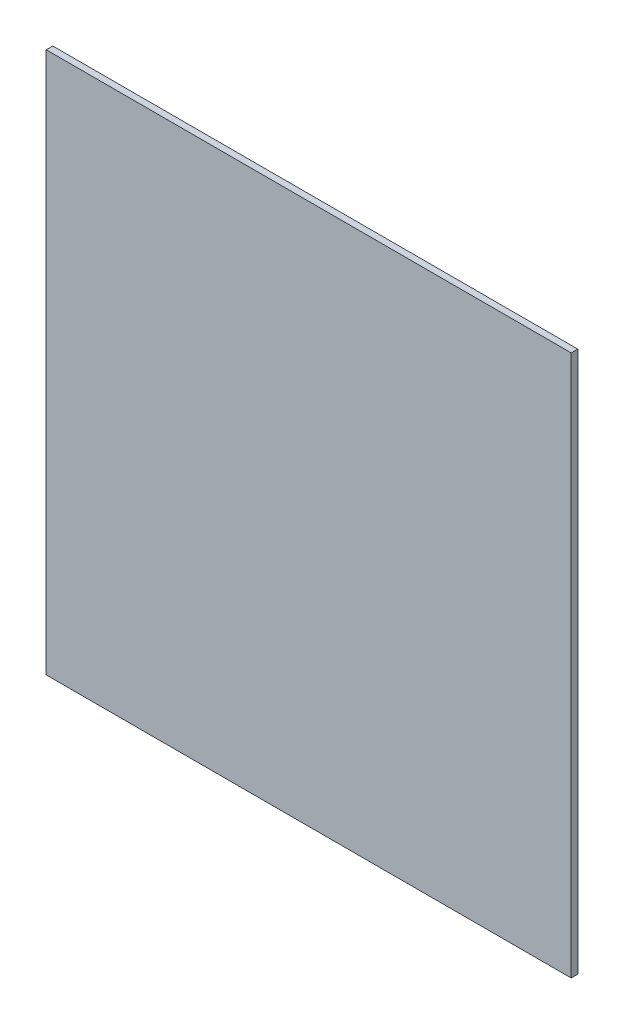
from build123d import *

# Parameters (mm, degrees)
SKETCH2_W           = 320
SKETCH2_H           = 330
BOSS_EXTRUDE2_DEPTH = 4


with BuildPart() as part:
    # Sketch2 → Boss-Extrude2 (new body)
    with BuildSketch(Plane.XY):
        with Locations((0, -5)):
            Rectangle(SKETCH2_W, SKETCH2_H)
    extrude(amount=BOSS_EXTRUDE2_DEPTH)


solid = part.part
